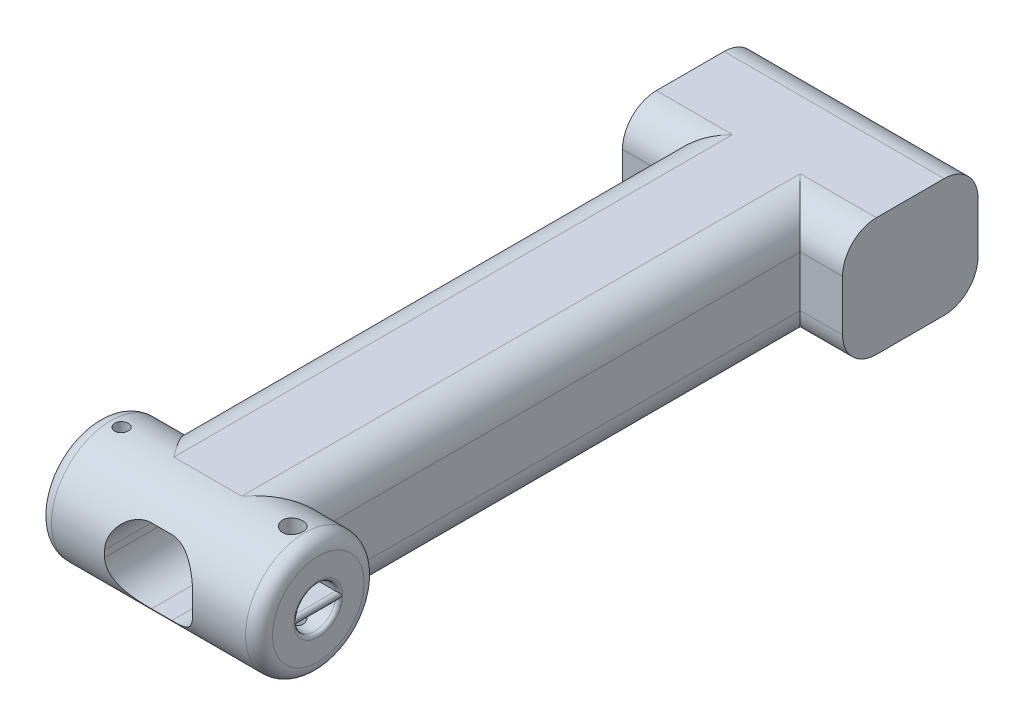
from build123d import *

# Parameters (mm, degrees)
CROQUIS1_R               = 8.75
SALIENTE_EXTRUIR1_DEPTH  = 32.651689968
CUT_EXTRUDE1_DEPTH       = 7
FILLET4_R                = 0.5
FILLET5_R                = 0.5
CUT_EXTRUDE2_DEPTH       = 7.5
FILLET7_R                = 0.5
FILLET9_R                = 2
CUT_EXTRUDE3_DEPTH       = 13.5
CUT_EXTRUDE3_DEPTH_BACK  = 7.5
SKETCH12_R               = 1
SKETCH12_R_2             = 1.5
BOSS_EXTRUDE1_DEPTH      = 10
BOSS_EXTRUDE1_DEPTH_BACK = 10
SKETCH14_W               = 87.493872756
SKETCH14_H               = 17.5
SKETCH16_W               = 32.5
SKETCH16_H               = 20
BOSS_EXTRUDE2_DEPTH      = 17.5
FILLET11_R               = 5
CUT_EXTRUDE6_DEPTH       = 150
SKETCH21_R               = 4
CUT_EXTRUDE7_DEPTH       = 5


with BuildPart() as part:
    # Croquis1 → Saliente-Extruir1 (new body)
    with BuildSketch(Plane(origin=(0, 0, 10.851797105), x_dir=(0, 0, -1), z_dir=(1, 0, 0))):
        Circle(CROQUIS1_R)
    extrude(amount=SALIENTE_EXTRUIR1_DEPTH)

    # Sketch2 → Cut-Extrude1 (cut)
    with BuildSketch(Plane(origin=(32.651689968, 0, 0), x_dir=(0, 0, -1), z_dir=(1, 0, 0))):
        with BuildLine():
            Line((-13.910392629, 0.504968734), (-7.793201582, 0.504968734))
            ThreePointArc((-7.793201582, 0.504968734), (-10.851797105, 3.1), (-13.910392629, 0.504968734))
        make_face()
        with BuildLine():
            Line((-13.910392629, -0.504968734), (-7.793201582, -0.504968734))
            ThreePointArc((-7.793201582, -0.504968734), (-10.851797105, -3.1), (-13.910392629, -0.504968734))
        make_face()
    extrude(amount=-CUT_EXTRUDE1_DEPTH, mode=Mode.SUBTRACT)

    # Fillet4
    fillet4_edges = [part.edges().sort_by_distance(p)[0] for p in [
        (32.651689968, -0.504968734, 10.851797105),
        (32.651689968, 0.504968734, 10.851797105),
    ]]
    fillet(fillet4_edges, radius=FILLET4_R)

    # Fillet5
    fillet5_edges = [part.edges().sort_by_distance(p)[0] for p in [
        (32.651689968, -3.1, 10.851797105),
        (32.651689968, 3.1, 10.851797105),
    ]]
    fillet(fillet5_edges, radius=FILLET5_R)

    # Sketch3 → Cut-Extrude2 (cut)
    with BuildSketch(Plane.ZY):
        with BuildLine():
            Line((9.067168864, 1.821428571), (12.636425346, 1.821428571))
            ThreePointArc((12.636425346, 1.821428571), (13.401797105, 0), (12.636425346, -1.821428571))
            Line((12.636425346, -1.821428571), (9.067168864, -1.821428571))
            ThreePointArc((9.067168864, -1.821428571), (8.301797105, 0), (9.067168864, 1.821428571))
        make_face()
    extrude(amount=-CUT_EXTRUDE2_DEPTH, mode=Mode.SUBTRACT)

    # Fillet7
    fillet7_edges = [part.edges().sort_by_distance(p)[0] for p in [
        (0, 0, 8.301797105),
        (0, -1.821428571, 10.851797105),
        (0, 0, 13.401797105),
        (0, 1.821428571, 10.851797105),
    ]]
    fillet(fillet7_edges, radius=FILLET7_R)

    # Fillet9
    fillet9_edges = [part.edges().sort_by_distance(p)[0] for p in [
        (0, 0, 19.601797105),
        (32.651689968, 0, 19.601797105),
    ]]
    fillet(fillet9_edges, radius=FILLET9_R)

    # Sketch12 → Cut-Extrude3 (cut, two sides: drawn at the far end of the back side and taken through both)
    with BuildSketch(Plane(origin=(0, -1.821428571, 0), x_dir=(1, 0, 0), z_dir=(0, 1, 0)).offset(-CUT_EXTRUDE3_DEPTH_BACK)):
        with Locations(Location((3.612386556, -10.851797105, 0), (0, 0, 90))):
            Circle(SKETCH12_R)
        with Locations(Location((28.883668284, -10.851797105, 0), (0, 0, 90))):
            Circle(SKETCH12_R_2)
    extrude(amount=CUT_EXTRUDE3_DEPTH + CUT_EXTRUDE3_DEPTH_BACK, mode=Mode.SUBTRACT)

    # Sketch14 → Boss-Extrude1 (add, two sides: drawn at the far end of the back side and taken through both)
    with BuildSketch(Plane(origin=(16.325844984, 0, 0), x_dir=(0, 0, -1), z_dir=(1, 0, 0)).offset(-BOSS_EXTRUDE1_DEPTH_BACK)):
        with Locations((32.895139273, 0)):
            Rectangle(SKETCH14_W, SKETCH14_H)
    extrude(amount=BOSS_EXTRUDE1_DEPTH + BOSS_EXTRUDE1_DEPTH_BACK)

    # Sketch16 → Boss-Extrude2 (add, through all)
    with BuildSketch(Plane(origin=(0, 8.75, 0), x_dir=(1, 0, 0), z_dir=(0, 1, 0))):
        with Locations((16.325844984, 76.642075651)):
            Rectangle(SKETCH16_W, SKETCH16_H)
    extrude(amount=-BOSS_EXTRUDE2_DEPTH)

    # Fillet11
    # the kernel refuses this fillet: 5 mm, written as the material it takes off along each edge
    with BuildSketch(Plane(origin=(26.325844984, -8.75, 23.351797105), x_dir=(-1, 0, 0), z_dir=(0, 0, -1))) as fillet11_piece_1_section:
        with BuildLine():
            CenterArc((FILLET11_R, FILLET11_R), FILLET11_R, 180, 90)
            Line((0, FILLET11_R), (0, 0))
            Line((0, 0), (FILLET11_R, 0))
        make_face()
    fillet11_piece_1 = extrude(amount=89.993872757, mode=Mode.PRIVATE)
    fillet11_piece_1 = fillet11_piece_1 - Plane(origin=(25.159469898, 0, 10.851797105), x_dir=(0, 0, -1), z_dir=(-1, 0, 0)) * Cylinder(8.75, 200, mode=Mode.PRIVATE)
    add(fillet11_piece_1, mode=Mode.SUBTRACT)
    with BuildSketch(Plane(origin=(6.325844984, -8.75, 23.351797105), x_dir=(0, 1, 0), z_dir=(0, 0, -1))) as fillet11_piece_2_section:
        with BuildLine():
            CenterArc((FILLET11_R, FILLET11_R), FILLET11_R, 180, 90)
            Line((0, FILLET11_R), (0, 0))
            Line((0, 0), (FILLET11_R, 0))
        make_face()
    fillet11_piece_2 = extrude(amount=89.993872757, mode=Mode.PRIVATE)
    fillet11_piece_2 = fillet11_piece_2 - Plane(origin=(7.492219967, 0, 10.851797105), x_dir=(0, 0, -1), z_dir=(-1, 0, 0)) * Cylinder(8.75, 200, mode=Mode.PRIVATE)
    add(fillet11_piece_2, mode=Mode.SUBTRACT)
    with BuildSketch(Plane(origin=(26.325844984, 8.75, -66.642075651), x_dir=(0, -1, 0), z_dir=(0, 0, 1))) as fillet11_piece_3_section:
        with BuildLine():
            CenterArc((FILLET11_R, -FILLET11_R), FILLET11_R, 90, 90)
            Line((0, -FILLET11_R), (0, 0))
            Line((0, 0), (FILLET11_R, 0))
        make_face()
    fillet11_piece_3 = extrude(amount=89.993872757, mode=Mode.PRIVATE)
    fillet11_piece_3 = fillet11_piece_3 - Plane(origin=(25.159468834, 0, 10.851797105), x_dir=(0, 0, -1), z_dir=(-1, 0, 0)) * Cylinder(8.75, 200, mode=Mode.PRIVATE)
    add(fillet11_piece_3, mode=Mode.SUBTRACT)
    with BuildSketch(Plane(origin=(6.325844984, 8.75, -66.642075651), x_dir=(0, -1, 0), z_dir=(0, 0, 1))) as fillet11_piece_4_section:
        with BuildLine():
            CenterArc((FILLET11_R, FILLET11_R), FILLET11_R, 180, 90)
            Line((0, FILLET11_R), (0, 0))
            Line((0, 0), (FILLET11_R, 0))
        make_face()
    fillet11_piece_4 = extrude(amount=89.993872757, mode=Mode.PRIVATE)
    fillet11_piece_4 = fillet11_piece_4 - Plane(origin=(7.492221134, 0, 10.851797105), x_dir=(0, 0, -1), z_dir=(-1, 0, 0)) * Cylinder(8.75, 200, mode=Mode.PRIVATE)
    add(fillet11_piece_4, mode=Mode.SUBTRACT)
    with BuildSketch(Plane(origin=(6.325844984, -8.75, -66.642075651), x_dir=(0, 0, -1), z_dir=(-1, 0, 0)), Plane(origin=(45.075844984, -8.75, -66.642075651), x_dir=(0, 0, -1), z_dir=(-1, 0, 0))) as fillet11_piece_5:
        with BuildLine():
            CenterArc((FILLET11_R, -FILLET11_R), FILLET11_R, 90, 90)
            Line((0, -FILLET11_R), (0, 0))
            Line((0, 0), (FILLET11_R, 0))
        make_face()
    extrude(amount=18.75, mode=Mode.SUBTRACT)
    with BuildSketch(Plane(origin=(-12.424155016, -8.75, -86.642075651), x_dir=(0, 0, 1), z_dir=(1, 0, 0))) as fillet11_piece_6:
        with BuildLine():
            CenterArc((FILLET11_R, -FILLET11_R), FILLET11_R, 90, 90)
            Line((0, -FILLET11_R), (0, 0))
            Line((0, 0), (FILLET11_R, 0))
        make_face()
    extrude(amount=57.5, mode=Mode.SUBTRACT)
    with BuildSketch(Plane(origin=(45.075844984, 8.75, -66.642075651), x_dir=(0, 0, -1), z_dir=(-1, 0, 0)), Plane(origin=(6.325844984, 8.75, -66.642075651), x_dir=(0, 0, -1), z_dir=(-1, 0, 0))) as fillet11_piece_7:
        with BuildLine():
            CenterArc((FILLET11_R, FILLET11_R), FILLET11_R, 180, 90)
            Line((0, FILLET11_R), (0, 0))
            Line((0, 0), (FILLET11_R, 0))
        make_face()
    extrude(amount=18.75, mode=Mode.SUBTRACT)
    with BuildSketch(Plane(origin=(-12.424155016, 8.75, -86.642075651), x_dir=(0, 0, 1), z_dir=(1, 0, 0))) as fillet11_piece_8:
        with BuildLine():
            CenterArc((FILLET11_R, FILLET11_R), FILLET11_R, 180, 90)
            Line((0, FILLET11_R), (0, 0))
            Line((0, 0), (FILLET11_R, 0))
        make_face()
    extrude(amount=57.5, mode=Mode.SUBTRACT)
    with BuildSketch(Plane(origin=(26.325844984, -8.75, 23.351797105), x_dir=(-1, 0, 0), z_dir=(0, 0, -1))) as fillet11_piece_9a_section:
        with BuildLine():
            CenterArc((FILLET11_R, FILLET11_R), FILLET11_R, 180, 90)
            Line((0, FILLET11_R), (0, 0))
            Line((0, 0), (FILLET11_R, 0))
        make_face()
    fillet11_piece_9a = extrude(amount=102.493872757, mode=Mode.PRIVATE)
    fillet11_piece_9a = split(fillet11_piece_9a, bisect_by=Plane(origin=(25.193869413, -7.618024429, -66.642075651), z_dir=(0, 0, -1)), keep=Keep.TOP, mode=Mode.PRIVATE)
    with BuildSketch(Plane(origin=(45.075844984, -8.75, -66.642075651), x_dir=(0, 0, -1), z_dir=(-1, 0, 0))) as fillet11_piece_9b_section:
        with BuildLine():
            CenterArc((FILLET11_R, -FILLET11_R), FILLET11_R, 90, 90)
            Line((0, -FILLET11_R), (0, 0))
            Line((0, 0), (FILLET11_R, 0))
        make_face()
    fillet11_piece_9b = extrude(amount=31.25, mode=Mode.PRIVATE)
    fillet11_piece_9b = split(fillet11_piece_9b, bisect_by=Plane(origin=(26.325844984, -7.618024429, -67.774051223), z_dir=(-1, 0, 0)), keep=Keep.TOP, mode=Mode.PRIVATE)
    fillet11_piece_9 = fillet11_piece_9a & fillet11_piece_9b
    add(fillet11_piece_9, mode=Mode.SUBTRACT)
    with BuildSketch(Plane(origin=(6.325844984, -8.75, 23.351797105), x_dir=(0, 1, 0), z_dir=(0, 0, -1))) as fillet11_piece_10a_section:
        with BuildLine():
            CenterArc((FILLET11_R, FILLET11_R), FILLET11_R, 180, 90)
            Line((0, FILLET11_R), (0, 0))
            Line((0, 0), (FILLET11_R, 0))
        make_face()
    fillet11_piece_10a = extrude(amount=102.493872757, mode=Mode.PRIVATE)
    fillet11_piece_10a = split(fillet11_piece_10a, bisect_by=Plane(origin=(7.457820555, -7.618024429, -66.642075651), z_dir=(0, 0, -1)), keep=Keep.TOP, mode=Mode.PRIVATE)
    with BuildSketch(Plane(origin=(18.825844984, -8.75, -66.642075651), x_dir=(0, 0, -1), z_dir=(-1, 0, 0))) as fillet11_piece_10b_section:
        with BuildLine():
            CenterArc((FILLET11_R, -FILLET11_R), FILLET11_R, 90, 90)
            Line((0, -FILLET11_R), (0, 0))
            Line((0, 0), (FILLET11_R, 0))
        make_face()
    fillet11_piece_10b = extrude(amount=31.25, mode=Mode.PRIVATE)
    fillet11_piece_10b = split(fillet11_piece_10b, bisect_by=Plane(origin=(6.325844984, -7.618024429, -67.774051223), z_dir=(1, 0, 0)), keep=Keep.TOP, mode=Mode.PRIVATE)
    fillet11_piece_10 = fillet11_piece_10a & fillet11_piece_10b
    add(fillet11_piece_10, mode=Mode.SUBTRACT)
    with BuildSketch(Plane(origin=(26.325844984, 8.75, -79.142075651), x_dir=(0, -1, 0), z_dir=(0, 0, 1))) as fillet11_piece_11a_section:
        with BuildLine():
            CenterArc((FILLET11_R, -FILLET11_R), FILLET11_R, 90, 90)
            Line((0, -FILLET11_R), (0, 0))
            Line((0, 0), (FILLET11_R, 0))
        make_face()
    fillet11_piece_11a = extrude(amount=102.493872757, mode=Mode.PRIVATE)
    fillet11_piece_11a = split(fillet11_piece_11a, bisect_by=Plane(origin=(25.193869413, 7.618024429, -66.642075651), z_dir=(0, 0, -1)), keep=Keep.TOP, mode=Mode.PRIVATE)
    with BuildSketch(Plane(origin=(45.075844984, 8.75, -66.642075651), x_dir=(0, 0, -1), z_dir=(-1, 0, 0))) as fillet11_piece_11b_section:
        with BuildLine():
            CenterArc((FILLET11_R, FILLET11_R), FILLET11_R, 180, 90)
            Line((0, FILLET11_R), (0, 0))
            Line((0, 0), (FILLET11_R, 0))
        make_face()
    fillet11_piece_11b = extrude(amount=31.25, mode=Mode.PRIVATE)
    fillet11_piece_11b = split(fillet11_piece_11b, bisect_by=Plane(origin=(26.325844984, 7.618024429, -67.774051223), z_dir=(-1, 0, 0)), keep=Keep.TOP, mode=Mode.PRIVATE)
    fillet11_piece_11 = fillet11_piece_11a & fillet11_piece_11b
    add(fillet11_piece_11, mode=Mode.SUBTRACT)
    with BuildSketch(Plane(origin=(6.325844984, 8.75, -79.142075651), x_dir=(0, -1, 0), z_dir=(0, 0, 1))) as fillet11_piece_12a_section:
        with BuildLine():
            CenterArc((FILLET11_R, FILLET11_R), FILLET11_R, 180, 90)
            Line((0, FILLET11_R), (0, 0))
            Line((0, 0), (FILLET11_R, 0))
        make_face()
    fillet11_piece_12a = extrude(amount=102.493872757, mode=Mode.PRIVATE)
    fillet11_piece_12a = split(fillet11_piece_12a, bisect_by=Plane(origin=(7.457820555, 7.618024429, -66.642075651), z_dir=(0, 0, -1)), keep=Keep.TOP, mode=Mode.PRIVATE)
    with BuildSketch(Plane(origin=(18.825844984, 8.75, -66.642075651), x_dir=(0, 0, -1), z_dir=(-1, 0, 0))) as fillet11_piece_12b_section:
        with BuildLine():
            CenterArc((FILLET11_R, FILLET11_R), FILLET11_R, 180, 90)
            Line((0, FILLET11_R), (0, 0))
            Line((0, 0), (FILLET11_R, 0))
        make_face()
    fillet11_piece_12b = extrude(amount=31.25, mode=Mode.PRIVATE)
    fillet11_piece_12b = split(fillet11_piece_12b, bisect_by=Plane(origin=(6.325844984, 7.618024429, -67.774051223), z_dir=(1, 0, 0)), keep=Keep.TOP, mode=Mode.PRIVATE)
    fillet11_piece_12 = fillet11_piece_12a & fillet11_piece_12b
    add(fillet11_piece_12, mode=Mode.SUBTRACT)

    # Sketch19 → Cut-Extrude6 (cut)
    with BuildSketch(Plane(origin=(0, 0, -86.642075651), x_dir=(-1, 0, 0), z_dir=(0, 0, -1))):
        with BuildLine():
            Line((-17.825844984, 5.5), (-14.825844984, 5.5))
            ThreePointArc((-14.825844984, 5.5), (-11.290311078, 4.035533906), (-9.825844984, 0.5))
            Line((-9.825844984, 0.5), (-9.825844984, -0.5))
            ThreePointArc((-9.825844984, -0.5), (-11.290311078, -4.035533906), (-14.825844984, -5.5))
            Line((-14.825844984, -5.5), (-17.825844984, -5.5))
            ThreePointArc((-17.825844984, -5.5), (-21.36137889, -4.035533906), (-22.825844984, -0.5))
            Line((-22.825844984, -0.5), (-22.825844984, 0.5))
            ThreePointArc((-22.825844984, 0.5), (-21.36137889, 4.035533906), (-17.825844984, 5.5))
        make_face()
    extrude(amount=-CUT_EXTRUDE6_DEPTH, mode=Mode.SUBTRACT)

    # Sketch21 → Cut-Extrude7 (cut)
    with BuildSketch(Plane.ZY.offset(-0.075844984)):
        with Locations((-76.642075651, 0)):
            Circle(SKETCH21_R)
    extrude(amount=-CUT_EXTRUDE7_DEPTH, mode=Mode.SUBTRACT)


solid = part.part
